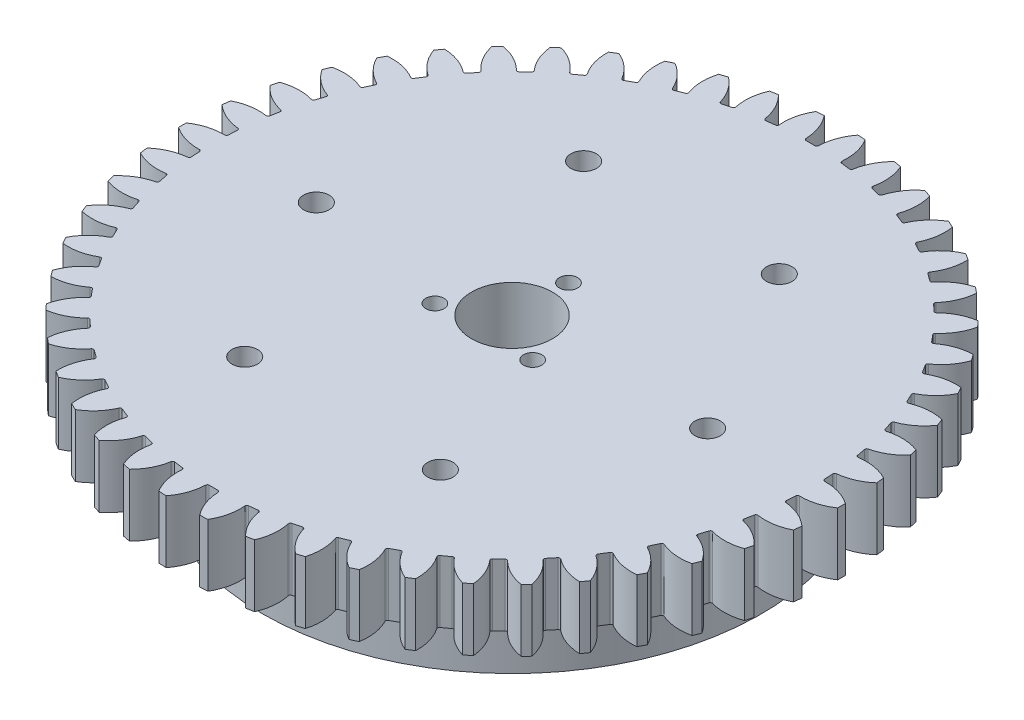
from build123d import *

# Parameters (mm, degrees)
SKETCH1_R           = 40
SKETCH1_R_2         = 2.05
SKETCH1_R_3         = 6.5
SKETCH1_R_4         = 1.55
BOSS_EXTRUDE2_DEPTH = 11.5
SKETCH2_R           = 52.889434311
BOSS_EXTRUDE3_DEPTH = 10
CUT_EXTRUDE1_START  = 11.5
SKETCH1_2_R         = 2.05
SKETCH1_2_R_2       = 6.5
SKETCH1_2_R_3       = 1.55
CUT_EXTRUDE1_DEPTH  = 10
CUT_EXTRUDE2_START  = -10
CUT_EXTRUDE2_DEPTH  = 10
CIRPATTERN1_COUNT   = 50
SKETCH1_3_R         = 1.55
BOSS_EXTRUDE4_DEPTH = 3
CHAMFER1_SIZE       = 20
CHAMFER1_SIZE_2     = 1.2


with BuildPart() as part:
    # Sketch1 → Boss-Extrude2 (new body)
    with BuildSketch(Plane(origin=(0, 0, 0), x_dir=(1, 0, 0), z_dir=(0, 1, 0))):
        with Locations(Location((0, 0, 0), (0, 0, 270))):
            Circle(SKETCH1_R)
        with Locations(Location((-15.7, 27.193197679, 0), (0, 0, 270))):
            Circle(SKETCH1_R_2, mode=Mode.SUBTRACT)
        with Locations(Location((15.7, 27.193197679, 0), (0, 0, 270))):
            Circle(SKETCH1_R_2, mode=Mode.SUBTRACT)
        with Locations(Location((31.4, 0, 0), (0, 0, 270))):
            Circle(SKETCH1_R_2, mode=Mode.SUBTRACT)
        with Locations(Location((15.7, -27.193197679, 0), (0, 0, 270))):
            Circle(SKETCH1_R_2, mode=Mode.SUBTRACT)
        with Locations(Location((-15.7, -27.193197679, 0), (0, 0, 270))):
            Circle(SKETCH1_R_2, mode=Mode.SUBTRACT)
        with Locations(Location((-31.4, 0, 0), (0, 0, 270))):
            Circle(SKETCH1_R_2, mode=Mode.SUBTRACT)
        with Locations(Location((0, 0, 0), (0, 0, 270))):
            Circle(SKETCH1_R_3, mode=Mode.SUBTRACT)
        with Locations(Location((0, 9.064399226, 0), (0, 0, 270))):
            Circle(SKETCH1_R_4, mode=Mode.SUBTRACT)
        with Locations(Location((-7.85, -4.532199613, 0), (0, 0, 270))):
            Circle(SKETCH1_R_4, mode=Mode.SUBTRACT)
        with Locations(Location((7.85, -4.532199613, 0), (0, 0, 270))):
            Circle(SKETCH1_R_4, mode=Mode.SUBTRACT)
    extrude(amount=BOSS_EXTRUDE2_DEPTH)

    # Sketch2 → Boss-Extrude3 (add)
    with BuildSketch(Plane(origin=(0, 11.5, 0), x_dir=(1, 0, 0), z_dir=(0, 1, 0))):
        with Locations(Location((0, 0, 0), (0, 0, 270))):
            Circle(SKETCH2_R)
    extrude(amount=BOSS_EXTRUDE3_DEPTH)

    # Sketch1<2> → Cut-Extrude1 (cut)
    with BuildSketch(Plane(origin=(0, 0, 0), x_dir=(1, 0, 0), z_dir=(0, 1, 0)).offset(CUT_EXTRUDE1_START)):
        with Locations(Location((-31.4, 0, 0), (0, 0, 270))):
            Circle(SKETCH1_2_R)
        with Locations(Location((-15.7, -27.193197679, 0), (0, 0, 270))):
            Circle(SKETCH1_2_R)
        with Locations(Location((15.7, -27.193197679, 0), (0, 0, 270))):
            Circle(SKETCH1_2_R)
        with Locations(Location((31.4, 0, 0), (0, 0, 270))):
            Circle(SKETCH1_2_R)
        with Locations(Location((0, 0, 0), (0, 0, 270))):
            Circle(SKETCH1_2_R_2)
        with Locations(Location((-7.85, -4.532199613, 0), (0, 0, 270))):
            Circle(SKETCH1_2_R_3)
        with Locations(Location((7.85, -4.532199613, 0), (0, 0, 270))):
            Circle(SKETCH1_2_R_3)
        with Locations(Location((0, 9.064399226, 0), (0, 0, 270))):
            Circle(SKETCH1_2_R_3)
        with Locations(Location((-15.7, 27.193197679, 0), (0, 0, 270))):
            Circle(SKETCH1_2_R)
        with Locations(Location((15.7, 27.193197679, 0), (0, 0, 270))):
            Circle(SKETCH1_2_R)
    extrude(amount=CUT_EXTRUDE1_DEPTH, mode=Mode.SUBTRACT)

    # Sketch3 → Cut-Extrude2 (cut)
    with BuildSketch(Plane(origin=(0, 21.5, 0), x_dir=(1, 0, 0), z_dir=(0, 1, 0)).offset(CUT_EXTRUDE2_START)):
        with BuildLine():
            Line((0, 55.889434311), (0, 52.889434311))
            ThreePointArc((0, 52.889434311), (1.350636318, 52.872185913), (2.700391692, 52.820451971))
            ThreePointArc((2.700391692, 52.820451971), (5.496297764, 55.081379155), (9, 55.889434311))
            Line((9, 55.889434311), (0, 55.889434311))
        make_face()
        with BuildLine():
            ThreePointArc((2.700391692, 52.820451971), (1.350636318, 52.872185913), (0, 52.889434311))
            Line((0, 52.889434311), (0, 47.889434311))
            Line((0, 47.889434311), (0.705423459, 47.889434311))
            ThreePointArc((0.705423459, 47.889434311), (0.913686499, 47.973502595), (1.00522743, 48.178590937))
            ThreePointArc((1.00522743, 48.178590937), (1.48541088, 50.633692018), (2.700391692, 52.820451971))
        make_face()
        with BuildLine():
            Line((0, 47.889434311), (0, 52.889434311))
            ThreePointArc((0, 52.889434311), (-1.350636318, 52.872185913), (-2.700391692, 52.820451971))
            ThreePointArc((-2.700391692, 52.820451971), (-1.48541088, 50.633692018), (-1.00522743, 48.178590937))
            ThreePointArc((-1.00522743, 48.178590937), (-0.913686499, 47.973502595), (-0.705423459, 47.889434311))
            Line((-0.705423459, 47.889434311), (0, 47.889434311))
        make_face()
        with BuildLine():
            ThreePointArc((-2.700391692, 52.820451971), (-1.350636318, 52.872185913), (0, 52.889434311))
            Line((0, 52.889434311), (0, 55.889434311))
            Line((0, 55.889434311), (-9, 55.889434311))
            ThreePointArc((-9, 55.889434311), (-5.496297764, 55.081379155), (-2.700391692, 52.820451971))
        make_face()
    cut_extrude2 = extrude(amount=CUT_EXTRUDE2_DEPTH, mode=Mode.SUBTRACT)

    # CirPattern1: Cut-Extrude2 ×50 about axis
    cirpattern1_axis = Axis((0, 0, 0), (0, 1, 0))
    for i in range(1, CIRPATTERN1_COUNT):
        add(cut_extrude2.rotate(cirpattern1_axis, i * 360 / CIRPATTERN1_COUNT), mode=Mode.SUBTRACT)

    # Sketch1<3> → Boss-Extrude4 (add)
    with BuildSketch(Plane(origin=(0, 0, 0), x_dir=(1, 0, 0), z_dir=(0, 1, 0))):
        with Locations(Location((-7.85, -4.532199613, 0), (0, 0, 270))):
            Circle(SKETCH1_3_R)
        with Locations(Location((0, 9.064399226, 0), (0, 0, 270))):
            Circle(SKETCH1_3_R)
        with Locations(Location((7.85, -4.532199613, 0), (0, 0, 270))):
            Circle(SKETCH1_3_R)
    extrude(amount=BOSS_EXTRUDE4_DEPTH)

    # Chamfer1
    # the kernel refuses this chamfer: 20, 1.2 mm, written as the material it adds along each edge
    with BuildSketch(Plane(origin=(0, 3, -9.064399226), x_dir=(0, 0, 1), z_dir=(-1, 0, 0))) as chamfer1_piece_1_section:
        Polygon((1.55, CHAMFER1_SIZE), (1.55 - CHAMFER1_SIZE_2, 0), (1.55, 0), align=None)
    chamfer1_piece_1 = revolve(axis=Axis((0, 3, -9.064399226), (0, 1, 0)), mode=Mode.PRIVATE)
    chamfer1_piece_1 = split(chamfer1_piece_1, bisect_by=Plane(origin=(0, 21.5, -10.00098894), z_dir=(0, -1, 0)), keep=Keep.TOP, mode=Mode.PRIVATE)
    add(chamfer1_piece_1)
    with BuildSketch(Plane(origin=(-7.85, 3, 4.532199613), x_dir=(0, 0, 1), z_dir=(-1, 0, 0))) as chamfer1_piece_2_section:
        Polygon((1.55, CHAMFER1_SIZE), (1.55 - CHAMFER1_SIZE_2, 0), (1.55, 0), align=None)
    chamfer1_piece_2 = revolve(axis=Axis((-7.85, 3, 4.532199613), (0, 1, 0)), mode=Mode.PRIVATE)
    chamfer1_piece_2 = split(chamfer1_piece_2, bisect_by=Plane(origin=(-7.85, 21.5, 3.5956099), z_dir=(0, -1, 0)), keep=Keep.TOP, mode=Mode.PRIVATE)
    add(chamfer1_piece_2)
    with BuildSketch(Plane(origin=(7.85, 3, 4.532199613), x_dir=(0, 0, 1), z_dir=(-1, 0, 0))) as chamfer1_piece_3_section:
        Polygon((1.55, CHAMFER1_SIZE), (1.55 - CHAMFER1_SIZE_2, 0), (1.55, 0), align=None)
    chamfer1_piece_3 = revolve(axis=Axis((7.85, 3, 4.532199613), (0, 1, 0)), mode=Mode.PRIVATE)
    chamfer1_piece_3 = split(chamfer1_piece_3, bisect_by=Plane(origin=(7.85, 21.5, 3.5956099), z_dir=(0, -1, 0)), keep=Keep.TOP, mode=Mode.PRIVATE)
    add(chamfer1_piece_3)


solid = part.part
